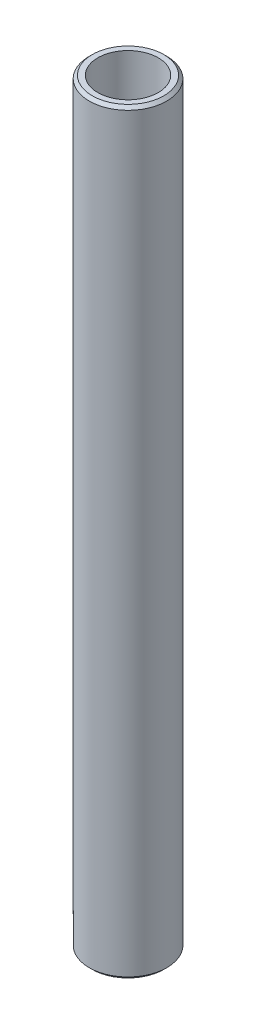
from build123d import *

# Parameters (mm, degrees)
SKETCH1_R           = 17.5
BOSS_EXTRUDE1_DEPTH = 341.243062089
SKETCH2_R           = 13.620543995
CUT_EXTRUDE1_DEPTH  = 343.139339194
CHAMFER1_SIZE       = 1.365792606


with BuildPart() as part:
    # Sketch1 → Boss-Extrude1 (new body)
    with BuildSketch(Plane(origin=(0, 0, 0), x_dir=(1, 0, 0), z_dir=(0, 1, 0))):
        Circle(SKETCH1_R)
    extrude(amount=BOSS_EXTRUDE1_DEPTH)

    # Sketch2 → Cut-Extrude1 (cut, through all)
    with BuildSketch(Plane(origin=(0, 0, 0), x_dir=(1, 0, 0), z_dir=(0, 1, 0))):
        Circle(SKETCH2_R)
    extrude(amount=CUT_EXTRUDE1_DEPTH, mode=Mode.SUBTRACT)

    # Chamfer1
    chamfer1_edges = [part.edges().sort_by_distance(p)[0] for p in [
        (-17.5, 341.243062089, 0),
        (-17.5, 0, 0),
    ]]
    chamfer(chamfer1_edges, length=CHAMFER1_SIZE)


solid = part.part
